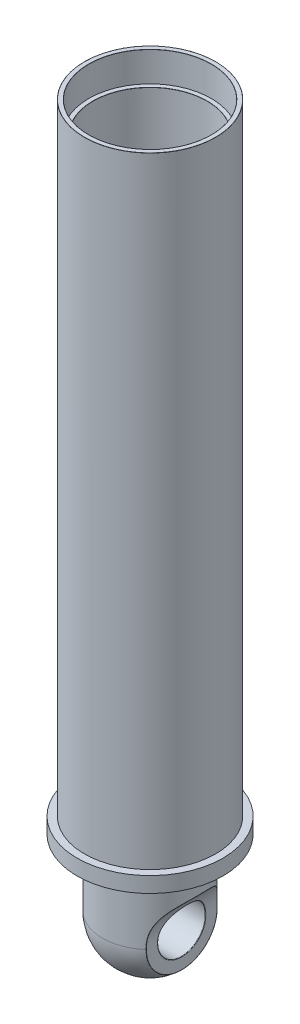
from build123d import *

# Parameters (mm, degrees)
CUT_EXTRUDE1_DEPTH      = 354.289614448
CUT_EXTRUDE1_DEPTH_BACK = 354.289614448
SKETCH2_R               = 11.083333333
CUT_EXTRUDE2_DEPTH      = 354.289614448
CUT_EXTRUDE2_DEPTH_BACK = 354.289614448
FILLET1_R               = 0.211111111
SKETCH8_R               = 28.6
CUT_EXTRUDE3_DEPTH      = 13.933333334
FILLET4_R               = 0.063333333


with BuildPart() as part:
    # Sketch1 → Revolve1 (revolve)
    with BuildSketch(Plane.XY):
        with BuildLine():
            Line((34.011407473, 60.436888915), (30.6, 60.436888915))
            Line((30.6, 60.436888915), (30.6, 350))
            Line((30.6, 350), (26.6, 350))
            Line((26.6, 350), (26.6, 60.436888915))
            Line((26.6, 60.436888915), (0, 60.436888915))
            Line((0, 60.436888915), (0, 0))
            ThreePointArc((0, 0), (15.674200316, 6.49246635), (22.166666667, 22.166666667))
            Line((22.166666667, 22.166666667), (22.166666667, 53.2))
            Line((22.166666667, 53.2), (34.011407473, 53.2))
            Line((34.011407473, 53.2), (34.011407473, 60.436888915))
        make_face()
    revolve(axis=Axis((0, 0, 0), (0, 1, 0)))

    # Sketch2 → Cut-Extrude1 (cut, two sides: drawn at the far end of the back side and taken through both)
    with BuildSketch(Plane(origin=(0, 0, 0), x_dir=(0, 0, -1), z_dir=(1, 0, 0)).offset(-CUT_EXTRUDE1_DEPTH_BACK)):
        with Locations((0, 22.166666667)):
            Circle(SKETCH2_R)
    extrude(amount=CUT_EXTRUDE1_DEPTH + CUT_EXTRUDE1_DEPTH_BACK, mode=Mode.SUBTRACT)

    # Sketch3 → Cut-Extrude2 (cut, two sides: drawn at the far end of the back side and taken through both)
    with BuildSketch(Plane.XY.offset(-CUT_EXTRUDE2_DEPTH_BACK)):
        with BuildLine():
            Line((-53.328502415, 44.333333333), (-53.328502415, 0))
            Line((-53.328502415, 0), (-14.777777778, 0))
            add(Edge.make_bspline(
                [(-14.777777778, 0), (-14.777777778, 7.305324074), (-14.777777778, 14.610648148), (-14.777777778, 21.915972222), (-14.777777778, 22.061111111), (-14.777777778, 22.351388889), (-14.777777778, 22.786805556), (-14.777777778, 23.077083333), (-14.777777778, 23.222222222), (-14.777777778, 23.429412658), (-14.777777778, 23.84379353), (-14.811359075, 24.465431829), (-14.841848545, 24.878734518), (-14.86013152, 25.085116711), (-15.876419115, 36.557191682), (-24.371886474, 44.333333333), (-35.888888889, 44.333333333)],
                knots=[0, 0, 0, 0, 0.408919191, 0.408919191, 0.408919191, 0.417043413, 0.425167636, 0.433291858, 0.433291858, 0.433291858, 0.444889447, 0.456487036, 0.468084625, 0.468084625, 0.468084625, 1, 1, 1, 1], degree=3, weights=[1, 1, 1, 1, 1, 1, 1, 1, 1, 1, 1, 1, 1, 1, 0.825097136, 0.825097136, 1]))
            Line((-35.888888889, 44.333333333), (-53.328502415, 44.333333333))
        make_face()
        with BuildLine():
            Line((35.888888889, 44.333333333), (53.328502415, 44.333333333))
            Line((53.328502415, 44.333333333), (53.328502415, 0))
            Line((53.328502415, 0), (14.777777778, 0))
            add(Edge.make_bspline(
                [(14.777777778, 0), (14.777777778, 7.305324074), (14.777777778, 14.610648148), (14.777777778, 21.915972222), (14.777777778, 22.061111111), (14.777777778, 22.351388889), (14.777777778, 22.786805556), (14.777777778, 23.077083333), (14.777777778, 23.222222222), (14.777777778, 23.429412658), (14.777777778, 23.84379353), (14.811359075, 24.465431829), (14.841848545, 24.878734518), (14.86013152, 25.085116711), (15.876419115, 36.557191682), (24.371886474, 44.333333333), (35.888888889, 44.333333333)],
                knots=[0, 0, 0, 0, 0.408919191, 0.408919191, 0.408919191, 0.417043413, 0.425167636, 0.433291858, 0.433291858, 0.433291858, 0.444889447, 0.456487036, 0.468084625, 0.468084625, 0.468084625, 1, 1, 1, 1], degree=3, weights=[1, 1, 1, 1, 1, 1, 1, 1, 1, 1, 1, 1, 1, 1, 0.825097136, 0.825097136, 1]))
        make_face()
    extrude(amount=CUT_EXTRUDE2_DEPTH + CUT_EXTRUDE2_DEPTH_BACK, mode=Mode.SUBTRACT)

    # Fillet1
    fillet1_edges = [part.edges().sort_by_distance(p)[0] for p in [
        (-14.777777778, 22.286131468, 11.082689468),
        (14.777777778, 22.286131468, 11.082689468),
        (-18.292842137, 34.886618953, 12.519306597),
        (-14.777777778, 10.483807306, 11.682858936),
        (18.292842008, 34.886618758, -12.519306785),
        (14.777777778, 10.483807518, -11.682859148),
    ]]
    fillet(fillet1_edges, radius=FILLET1_R)

    # Sketch8 → Cut-Extrude3 (cut)
    with BuildSketch(Plane(origin=(0, 350, 0), x_dir=(1, 0, 0), z_dir=(0, 1, 0))):
        Circle(SKETCH8_R)
    extrude(amount=-CUT_EXTRUDE3_DEPTH, mode=Mode.SUBTRACT)

    # Fillet4
    fillet4_edges = [part.edges().sort_by_distance(p)[0] for p in [
        (-30.6, 350, 0),
        (-28.6, 350, 0),
        (-26.6, 336.066666666, 0),
    ]]
    fillet(fillet4_edges, radius=FILLET4_R)


solid = part.part
